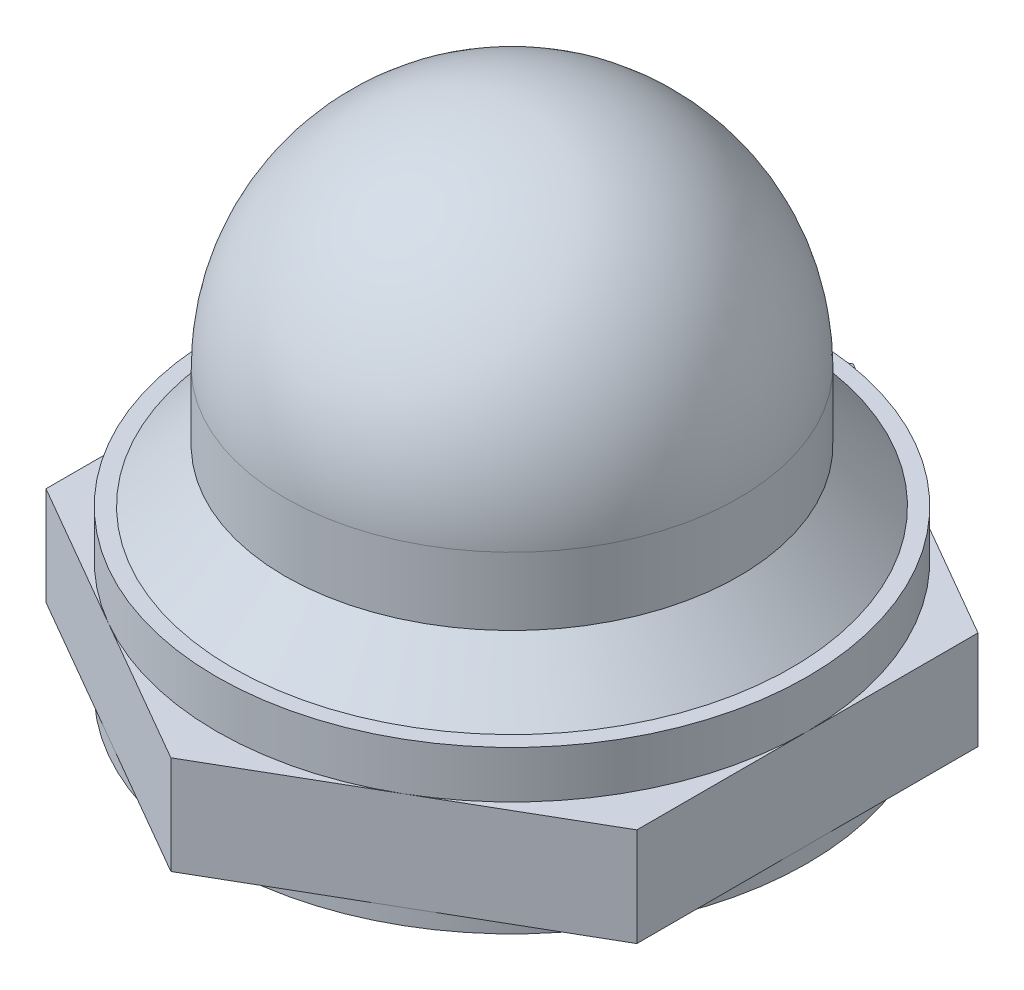
from build123d import *

# Parameters (mm, degrees)
SKETCH1_R           = 3.175
BOSS_EXTRUDE1_DEPTH = 1.5875
SKETCH2_W           = 1.5875
SKETCH2_H           = 0.254


with BuildPart() as part:
    # Sketch1 → Boss-Extrude1 (new body)
    with BuildSketch(Plane(origin=(0, 0, 0), x_dir=(1, 0, 0), z_dir=(0, 1, 0))):
        Polygon((4.7625, 2.749630657), (0, 5.499261314), (-4.7625, 2.749630657), (-4.7625, -2.749630657), (0, -5.499261314), (4.7625, -2.749630657), align=None)
        Circle(SKETCH1_R, mode=Mode.SUBTRACT)
    extrude(amount=BOSS_EXTRUDE1_DEPTH)

    # Sketch2 → Revolve1 (revolve)
    with BuildSketch(Plane(origin=(0, 0, 0), x_dir=(0, 0, -1), z_dir=(1, 0, 0))):
        with BuildLine():
            Line((3.6576, 3.2004), (3.6576, 4.2926))
            ThreePointArc((3.6576, 4.2926), (2.586313763, 6.878913763), (0, 7.9502))
            Line((0, 7.9502), (0, 7.4676))
            ThreePointArc((0, 7.4676), (2.24506403, 6.53766403), (3.175, 4.2926))
            Line((3.175, 4.2926), (3.175, 1.5875))
            Line((3.175, 1.5875), (4.7625, 1.5875))
            Line((4.7625, 1.5875), (4.7625, 2.3495))
            Line((4.7625, 2.3495), (4.5085, 2.3495))
            Line((4.5085, 2.3495), (3.6576, 3.2004))
        make_face()
        with Locations((3.96875, -0.127)):
            Rectangle(SKETCH2_W, SKETCH2_H)
    revolve(axis=Axis((0, 0, 0), (0, 1, 0)))


solid = part.part
